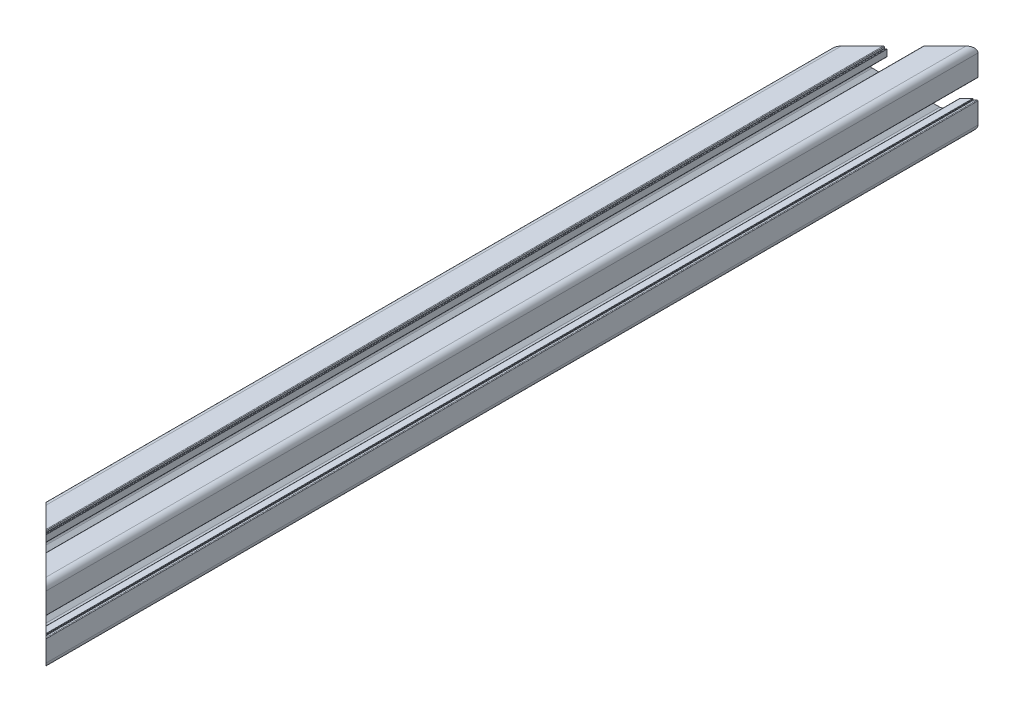
from build123d import *

# Parameters (mm, degrees)
BOSS_EXTRUDE1_DEPTH      = 1524
FILLET4_R                = 1.885
FILLET5_R                = 0.377
DELETEFACE1_START        = -1524
DELETEFACE1_DEPTH        = 3048
CUT_EXTRUDE1_START       = -1524
CUT_EXTRUDE1_DEPTH       = 3048
CIRPATTERN2_COUNT        = 3
CIRPATTERN2_ANGLE        = 180
FILLET2_R                = 0.377
FILLET3_R                = 0.1885
CUT_EXTRUDE2_START       = -3048
SKETCH5_R                = 6.375
CUT_EXTRUDE2_DEPTH       = 3048
BOSS_EXTRUDE2_DEPTH      = 1524
FILLET6_R                = 0.377
CIRPATTERN1_COUNT        = 8
FILLET6_OF_CIRPATTERN1_R = 0.377
CUT_EXTRUDE3_START       = -1524
CUT_EXTRUDE3_DEPTH       = 3048
SKETCH8_W                = 45.240738986
SKETCH8_H                = 45
CUT_EXTRUDE4_DEPTH       = 2484
CUT_EXTRUDE5_DEPTH       = 2484
CUT_EXTRUDE6_DEPTH       = 2484


# Read off the part's stored shape, not the designer's step: DeleteFace1
with BuildPart() as part:
    # Sketch3 → Boss-Extrude1 (new, symmetric)
    with BuildSketch(Plane.XY):
        with BuildLine():
            Line((0, -8), (0, -5))
            ThreePointArc((0, -5), (3.535533906, -3.535533906), (5, 0))
            Line((5, 0), (8, 0))
            ThreePointArc((8, 0), (7.57237156, -2.58054044), (6.335202759, -4.885202759))
            Line((6.335202759, -4.885202759), (11.5, -10.05))
            Line((11.5, -10.05), (16.7, -10.05))
            Line((16.7, -10.05), (16.7, -5))
            Line((16.7, -5), (21.05, -5))
            Line((21.05, -5), (21.05, 0))
            Line((21.05, 0), (22.5, 0))
            Line((22.5, 0), (22.5, -18.875))
            ThreePointArc((22.5, -18.875), (21.438262082, -21.438262082), (18.875, -22.5))
            Line((18.875, -22.5), (0, -22.5))
            Line((0, -22.5), (0, -21.05))
            Line((0, -21.05), (5, -21.05))
            Line((5, -21.05), (5, -16.7))
            Line((5, -16.7), (10.05, -16.7))
            Line((10.05, -16.7), (10.05, -11.5))
            Line((10.05, -11.5), (4.885202759, -6.335202759))
            ThreePointArc((4.885202759, -6.335202759), (2.58054044, -7.57237156), (0, -8))
        make_face()
        with BuildLine():
            Line((18.15, -8.79375), (18.15, -10.5575))
            ThreePointArc((18.15, -10.5575), (17.873948141, -11.223948141), (17.2075, -11.5))
            Line((17.2075, -11.5), (12.4425, -11.5))
            ThreePointArc((12.4425, -11.5), (11.776051859, -11.776051859), (11.5, -12.4425))
            Line((11.5, -12.4425), (11.5, -17.2075))
            ThreePointArc((11.5, -17.2075), (11.223948141, -17.873948141), (10.5575, -18.15))
            Line((10.5575, -18.15), (8.79375, -18.15))
            ThreePointArc((8.79375, -18.15), (7.34375, -19.6), (8.79375, -21.05))
            Line((8.79375, -21.05), (18.875, -21.05))
            ThreePointArc((18.875, -21.05), (20.412957249, -20.412957249), (21.05, -18.875))
            Line((21.05, -18.875), (21.05, -8.79375))
            ThreePointArc((21.05, -8.79375), (19.6, -7.34375), (18.15, -8.79375))
        make_face(mode=Mode.SUBTRACT)
    extrude(amount=BOSS_EXTRUDE1_DEPTH, both=True)

    # Fillet4
    fillet4_edges = [part.edges().sort_by_distance(p)[0] for p in [
        (10.05, -11.5, 0),
        (4.885202759, -6.335202759, 0),
        (6.335202759, -4.885202759, 0),
        (11.5, -10.05, 0),
    ]]
    fillet(fillet4_edges, radius=FILLET4_R)

    # Fillet5
    fillet5_edges = [part.edges().sort_by_distance(p)[0] for p in [
        (5, -21.05, 0),
        (5, -16.7, 0),
        (10.05, -16.7, 0),
        (16.7, -10.05, 0),
        (16.7, -5, 0),
        (21.05, -5, 0),
    ]]
    fillet(fillet5_edges, radius=FILLET5_R)

    # Mirror1: part across plane


with BuildPart() as part_1:
    add(part.part)
    add(part.part.mirror(Plane.ZX))

    # DeleteFace1 outline → DeleteFace1 (cut)
    with BuildSketch(Plane.XY.offset(DELETEFACE1_START)):
        with BuildLine():
            ThreePointArc((4.623, 21.05), (4.889579257, 20.939579257), (5, 20.673))
            Line((5, 20.673), (5, 21.05))
            Line((5, 21.05), (4.623, 21.05))
        make_face()
    extrude(amount=DELETEFACE1_DEPTH, mode=Mode.SUBTRACT)

    # Sketch4 → Cut-Extrude1 (cut)
    with BuildSketch(Plane.XY.offset(CUT_EXTRUDE1_START)):
        Polygon((5.85, 21.05), (5.85, 22.5), (0, 22.5), (-5.85, 22.5), (-5.85, 21.05), (-5, 21.05), (-5, 16.7), (5, 16.7), (5, 21.05), align=None)
    cut_extrude1 = extrude(amount=CUT_EXTRUDE1_DEPTH, mode=Mode.SUBTRACT)

    # CirPattern2: Cut-Extrude1 ×3 about axis
    cirpattern2_axis = Axis((0, 0, 1489), (0, 0, -1))
    for i in range(1, CIRPATTERN2_COUNT):
        add(cut_extrude1.rotate(cirpattern2_axis, i * CIRPATTERN2_ANGLE / (CIRPATTERN2_COUNT - 1)), mode=Mode.SUBTRACT)

    # Fillet2
    fillet2_edges = [part_1.edges().sort_by_distance(p)[0] for p in [
        (5.85, 22.5, 0),
        (22.5, 5.85, 0),
        (22.5, -5.85, 0),
        (5.85, -22.5, 0),
    ]]
    fillet(fillet2_edges, radius=FILLET2_R)

    # Fillet3
    fillet3_edges = [part_1.edges().sort_by_distance(p)[0] for p in [
        (5, 21.05, 0),
        (5.85, 21.05, 0),
        (21.05, -5, 0),
        (21.05, -5.85, 0),
        (21.05, 5, 0),
        (21.05, 5.85, 0),
        (5, -21.05, 0),
        (5.85, -21.05, 0),
    ]]
    fillet(fillet3_edges, radius=FILLET3_R)

    # Mirror2: part across plane


with BuildPart() as part_2:
    add(part_1.part)
    add(part_1.part.mirror(Plane(origin=(0, 0, 0), x_dir=(0, 0, 1), z_dir=(1, 0, 0))))

    # Sketch5 → Cut-Extrude2 (cut)
    with BuildSketch(Plane.XY.offset(1524).offset(CUT_EXTRUDE2_START)):
        Circle(SKETCH5_R)
        Polygon((-0.580185128, 8), (0.580185128, 8), (0, 7.59375), align=None)
        Polygon((-8, 0.580185128), (-8, -0.580185128), (-7.59375, 0), align=None)
        Polygon((8, 0.580185128), (8, -0.580185128), (7.59375, 0), align=None)
        Polygon((-0.580185128, -8), (0.580185128, -8), (0, -7.59375), align=None)
    extrude(amount=CUT_EXTRUDE2_DEPTH, mode=Mode.SUBTRACT)

    # Sketch6 → Boss-Extrude2 (add, symmetric)
    with BuildSketch(Plane.XY):
        with BuildLine():
            Line((-0.97545161, -4.903926402), (-1.243700803, -6.252506163))
            ThreePointArc((-1.243700803, -6.252506163), (0, -6.375), (1.243700803, -6.252506163))
            Line((1.243700803, -6.252506163), (0.97545161, -4.903926402))
            ThreePointArc((0.97545161, -4.903926402), (0, -5), (-0.97545161, -4.903926402))
        make_face()
    boss_extrude2 = extrude(amount=BOSS_EXTRUDE2_DEPTH, both=True)

    # Fillet6
    fillet6_edges = [part_2.edges().sort_by_distance(p)[0] for p in [
        (-1.243700803, -6.252506163, 0),
        (1.243700803, -6.252506163, 0),
    ]]
    fillet(fillet6_edges, radius=FILLET6_R)

    # CirPattern1: Boss-Extrude2 ×8 about axis
    cirpattern1_axis = Axis((0, 0, 0), (0, 0, 1))
    for i in range(1, CIRPATTERN1_COUNT):
        add(boss_extrude2.rotate(cirpattern1_axis, i * 360 / CIRPATTERN1_COUNT))

    # Fillet6 of CirPattern1
    fillet6_of_cirpattern1_edges = [part_2.edges().sort_by_distance(p)[0] for p in [
        (3.541760235, -5.300618778, 0),
        (5.300618778, -3.541760235, 0),
        (6.252506163, -1.243700803, 0),
        (6.252506163, 1.243700803, 0),
        (5.300618778, 3.541760235, 0),
        (3.541760235, 5.300618778, 0),
        (1.243700803, 6.252506163, 0),
        (-1.243700803, 6.252506163, 0),
        (-3.541760235, 5.300618778, 0),
        (-5.300618778, 3.541760235, 0),
        (-6.252506163, 1.243700803, 0),
        (-6.252506163, -1.243700803, 0),
        (-5.300618778, -3.541760235, 0),
        (-3.541760235, -5.300618778, 0),
    ]]
    fillet(fillet6_of_cirpattern1_edges, radius=FILLET6_OF_CIRPATTERN1_R)

    # Sketch7 → Cut-Extrude3 (cut)
    with BuildSketch(Plane.XY.offset(CUT_EXTRUDE3_START)):
        Polygon((-7.031875, 16.7), (-6.596875, 17.135), (-6.161875, 16.7), align=None)
    extrude(amount=CUT_EXTRUDE3_DEPTH, mode=Mode.SUBTRACT)

    # Sketch8 → Cut-Extrude4 (cut)
    with BuildSketch(Plane.XY.offset(1524)):
        Rectangle(SKETCH8_W, SKETCH8_H)
    extrude(amount=-CUT_EXTRUDE4_DEPTH, mode=Mode.SUBTRACT)

    # Sketch9 → Cut-Extrude5 (cut)
    with BuildSketch(Plane(origin=(0, 22.5, 0), x_dir=(1, 0, 0), z_dir=(0, 1, 0))):
        Polygon((22.5, 960), (-22.5, 1005), (-22.5, 960), align=None)
    extrude(amount=-CUT_EXTRUDE5_DEPTH, mode=Mode.SUBTRACT)

    # Sketch10 → Cut-Extrude6 (cut)
    with BuildSketch(Plane(origin=(0, 22.5, 0), x_dir=(1, 0, 0), z_dir=(0, 1, 0))):
        Polygon((22.5, 1524), (-22.5, 1479), (-22.5, 1524), align=None)
    extrude(amount=-CUT_EXTRUDE6_DEPTH, mode=Mode.SUBTRACT)


solid = part_2.part
